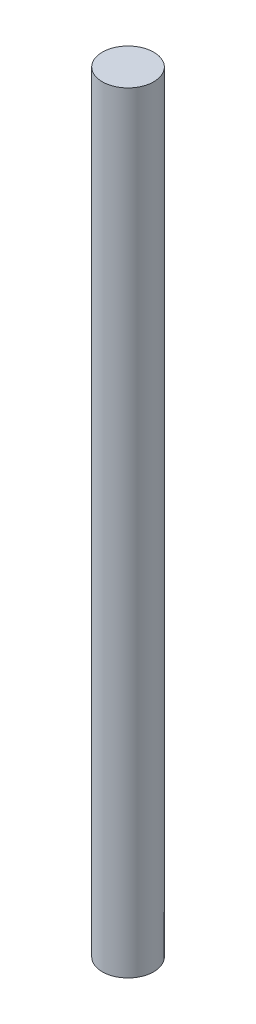
from build123d import *

# Parameters (mm, degrees)
SKETCH1_R           = 3
BOSS_EXTRUDE1_DEPTH = 90


with BuildPart() as part:
    # Sketch1 → Boss-Extrude1 (new body)
    with BuildSketch(Plane(origin=(0, 0, 0), x_dir=(1, 0, 0), z_dir=(0, 1, 0))):
        Circle(SKETCH1_R)
    extrude(amount=BOSS_EXTRUDE1_DEPTH)


solid = part.part
